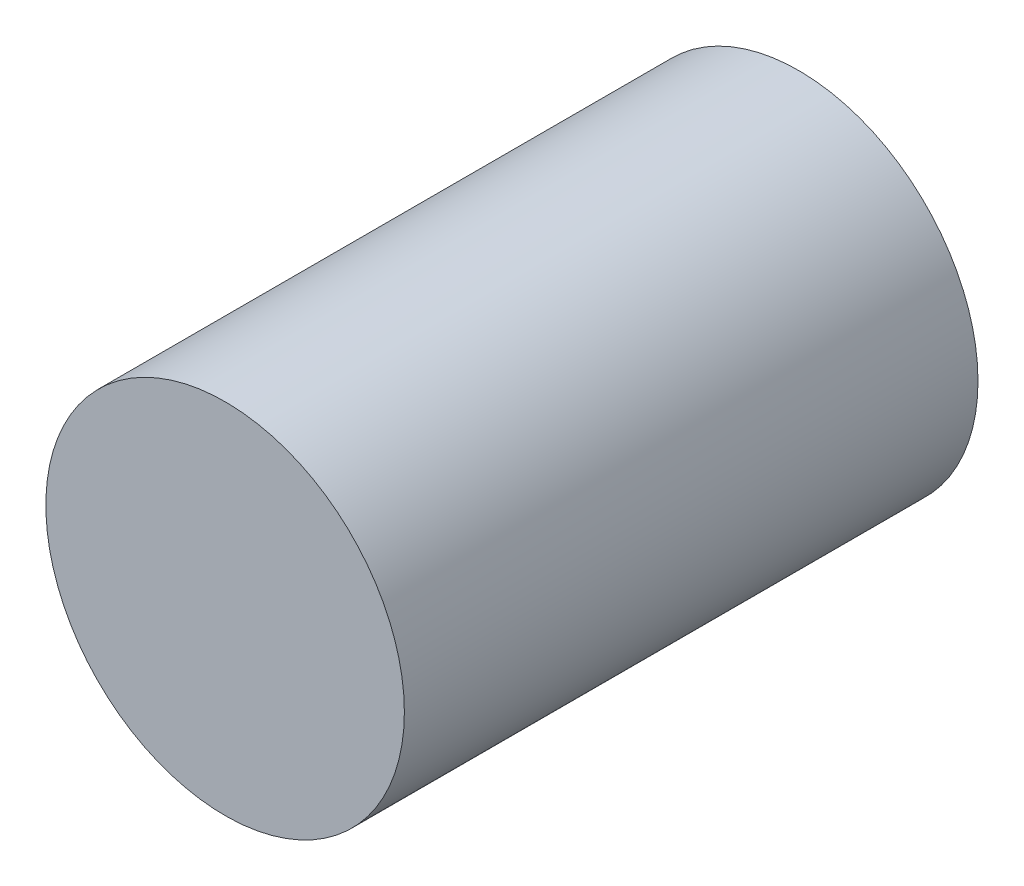
from build123d import *

# Parameters (mm, degrees)
SKETCH2_R = 2.5
SKETCH3_R = 2.5


with BuildPart() as part:
    # Sketch2 → Loft1 section 0
    with BuildSketch(Plane.XY):
        Circle(SKETCH2_R)
    # Sketch3 → Loft1 section 1
    with BuildSketch(Plane.XY.offset(8)):
        Circle(SKETCH3_R)
    loft()


solid = part.part
